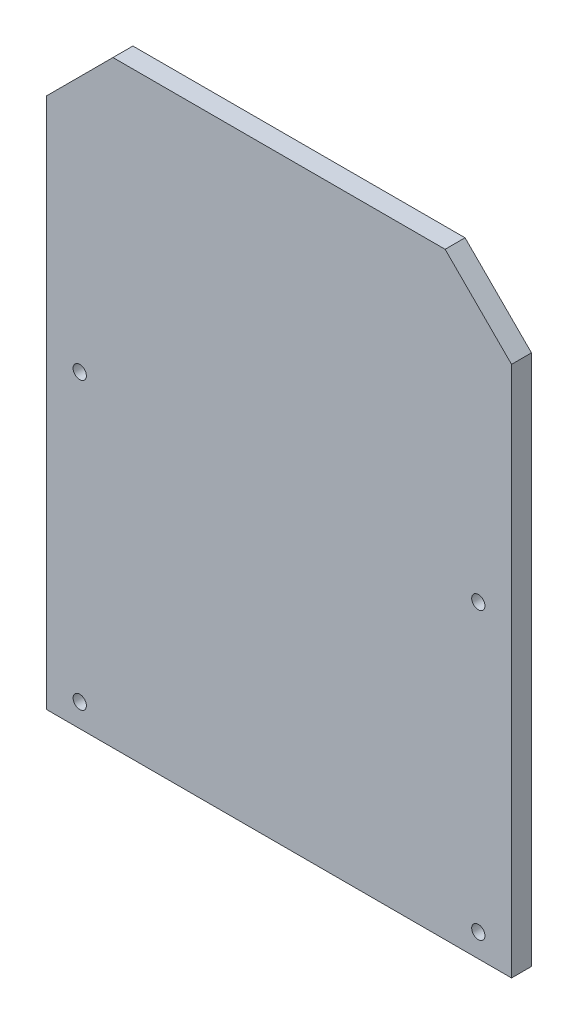
from build123d import *

# Parameters (mm, degrees)
CROQUIS1_W              = 70
CROQUIS1_H              = 90
SALIENTE_EXTRUIR1_DEPTH = 3
CROQUIS2_R              = 1
CORTAR_EXTRUIR1_DEPTH   = 3
CHAFL_N1_SIZE           = 10
CHAFL_N2_SIZE           = 10


with BuildPart() as part:
    # Croquis1 → Saliente-Extruir1 (new body)
    with BuildSketch(Plane.XY):
        with Locations((4.954489614, -8.071625344)):
            Rectangle(CROQUIS1_W, CROQUIS1_H)
    extrude(amount=SALIENTE_EXTRUIR1_DEPTH)

    # Croquis2 → Cortar-Extruir1 (cut)
    with BuildSketch(Plane(origin=(0, 0, 0), x_dir=(-1, 0, 0), z_dir=(0, 0, -1))):
        with Locations((-34.954489614, -49.571625344)):
            Circle(CROQUIS2_R)
        with Locations((25.045510386, -49.571625344)):
            Circle(CROQUIS2_R)
        with Locations((-34.954489614, -6.571625344)):
            Circle(CROQUIS2_R)
        with Locations((25.045510386, -6.571625344)):
            Circle(CROQUIS2_R)
    extrude(amount=-CORTAR_EXTRUIR1_DEPTH, mode=Mode.SUBTRACT)

    # Chaflán1
    chafl_n1_edges = [part.edges().sort_by_distance(p)[0] for p in [
        (39.954489614, 36.928374656, 1.5),
    ]]
    chamfer(chafl_n1_edges, length=CHAFL_N1_SIZE)

    # Chaflán2
    chafl_n2_edges = [part.edges().sort_by_distance(p)[0] for p in [
        (-30.045510386, 36.928374656, 1.5),
    ]]
    chamfer(chafl_n2_edges, length=CHAFL_N2_SIZE)


solid = part.part
